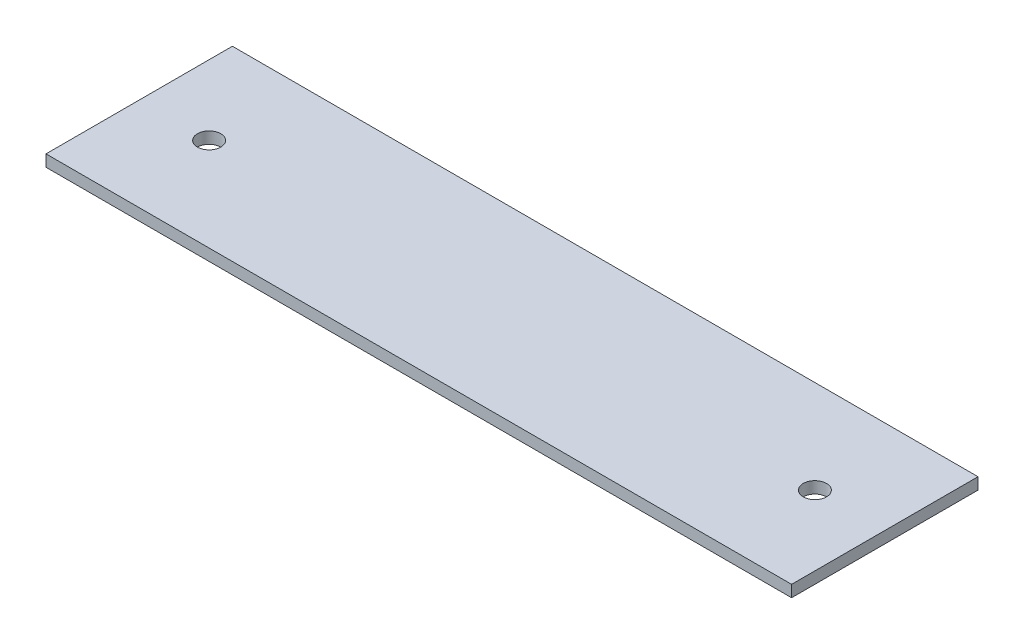
from build123d import *

# Parameters (mm, degrees)
SKETCH1_W           = 203.2
SKETCH1_H           = 50.8
BOSS_EXTRUDE1_DEPTH = 3.175
SKETCH2_R           = 3.175
CUT_EXTRUDE1_DEPTH  = 24.638


with BuildPart() as part:
    # Sketch1 → Boss-Extrude1 (new body)
    with BuildSketch(Plane(origin=(0, 0, 0), x_dir=(1, 0, 0), z_dir=(0, 1, 0))):
        with Locations((101.6, 25.4)):
            Rectangle(SKETCH1_W, SKETCH1_H)
    extrude(amount=BOSS_EXTRUDE1_DEPTH)

    # Sketch2 → Cut-Extrude1 (cut)
    with BuildSketch(Plane(origin=(0, 0, 0), x_dir=(-1, 0, 0), z_dir=(0, -1, 0))):
        with Locations((-184.15, 25.4)):
            Circle(SKETCH2_R)
        with Locations((-19.05, 25.4)):
            Circle(SKETCH2_R)
    extrude(amount=-CUT_EXTRUDE1_DEPTH, mode=Mode.SUBTRACT)


solid = part.part
